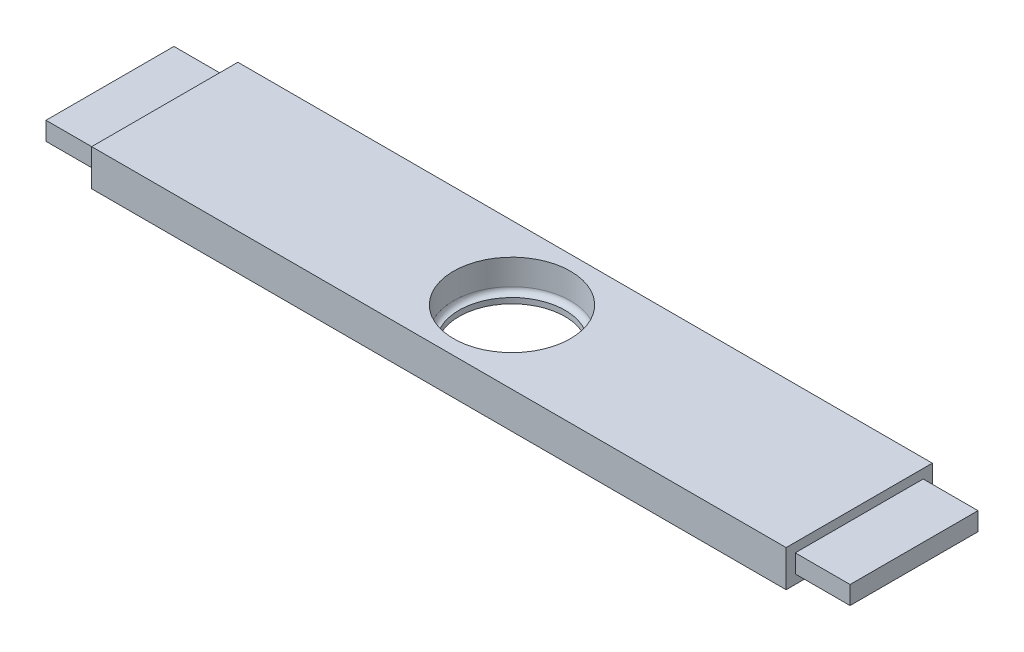
from build123d import *

# Parameters (mm, degrees)
ESBO_O1_W                  = 220
ESBO_O1_H                  = 40
RESSALTO_EXTRUS_O1_DEPTH   = 10
ESBO_O2_W                  = 40
ESBO_O2_H                  = 10
ESBO_O2_W_2                = 35
ESBO_O2_H_2                = 5
CORTE_EXTRUS_O1_DEPTH      = 15
CORTE_EXTRUS_O2_DEPTH      = 224.830292856
CORTE_EXTRUS_O2_DEPTH_BACK = 224.830292856
ESBO_O3_R                  = 14.5
CORTE_EXTRUS_O3_DEPTH      = 224.830292856
CORTE_EXTRUS_O3_DEPTH_BACK = 8.5
ESBO_O4_R                  = 16
ESBO_O4_R_2                = 14.5
FILETE1_R                  = 1.5


with BuildPart() as part:
    # Esboço1 → Ressalto-extrusão1 (new body)
    with BuildSketch(Plane(origin=(0, 0, 0), x_dir=(1, 0, 0), z_dir=(0, 1, 0))):
        with Locations((110, 20)):
            Rectangle(ESBO_O1_W, ESBO_O1_H)
    extrude(amount=RESSALTO_EXTRUS_O1_DEPTH)

    # Esboço2 → Corte-extrusão1 (cut)
    with BuildSketch(Plane.ZY):
        with Locations((-20, 5)):
            Rectangle(ESBO_O2_W, ESBO_O2_H)
        with Locations((-20, 5)):
            Rectangle(ESBO_O2_W_2, ESBO_O2_H_2, mode=Mode.SUBTRACT)
    corte_extrus_o1 = extrude(amount=-CORTE_EXTRUS_O1_DEPTH, mode=Mode.SUBTRACT)

    # Espelhar1: Corte-extrusão1 across plane
    add(corte_extrus_o1.mirror(Plane.ZY.offset(-110)), mode=Mode.SUBTRACT)

    # Esboço3 → Corte-extrusão2 (cut, two sides: drawn at the far end of the back side and taken through both)
    with BuildSketch(Plane(origin=(0, 0, 0), x_dir=(1, 0, 0), z_dir=(0, 1, 0)).offset(-CORTE_EXTRUS_O2_DEPTH_BACK)):
        with Locations(Location((110, 20, 0), (0, 0, 270))):
            Circle(ESBO_O3_R)
    extrude(amount=CORTE_EXTRUS_O2_DEPTH + CORTE_EXTRUS_O2_DEPTH_BACK, mode=Mode.SUBTRACT)

    # Esboço4 → Corte-extrusão3 (cut, two sides: drawn at the far end of the back side and taken through both)
    with BuildSketch(Plane(origin=(0, 10, 0), x_dir=(1, 0, 0), z_dir=(0, 1, 0)).offset(-CORTE_EXTRUS_O3_DEPTH_BACK)):
        with Locations(Location((110, 20, 0), (0, 0, 90))):
            Circle(ESBO_O4_R)
        with Locations(Location((110, 20, 0), (0, 0, 270))):
            Circle(ESBO_O4_R_2, mode=Mode.SUBTRACT)
    extrude(amount=CORTE_EXTRUS_O3_DEPTH + CORTE_EXTRUS_O3_DEPTH_BACK, mode=Mode.SUBTRACT)

    # Filete1
    filete1_edges = [part.edges().sort_by_distance(p)[0] for p in [
        (110, 1.5, -4),
    ]]
    fillet(filete1_edges, radius=FILETE1_R - 0.0001)  # a hair under: the kernel refuses the full size


solid = part.part
